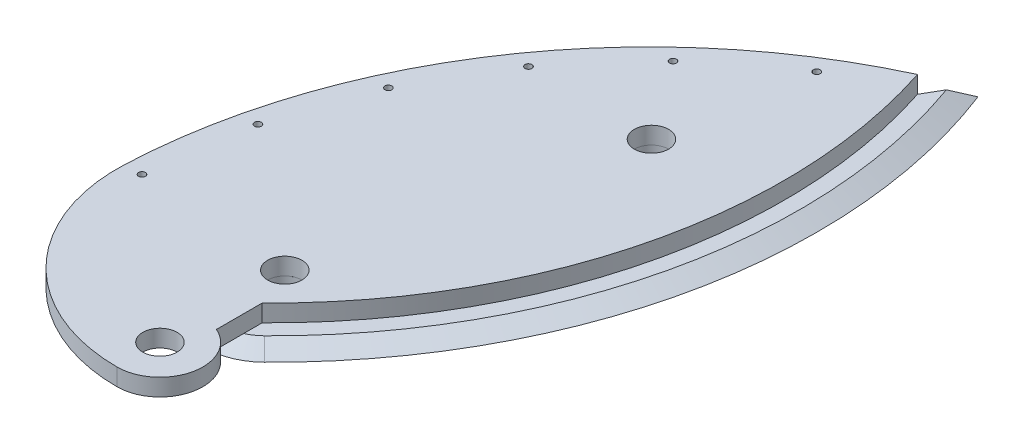
from build123d import *

# Parameters (mm, degrees)
IZIM1_R                     = 5
IZIM1_R_2                   = 12.5
Y_KSEKLIK_EKSTR_ZYON1_DEPTH = 5
IZIM2_R                     = 5
BLADE_DEPTH                 = 3
PAH1_SIZE                   = 3
PAH1_SIZE_2                 = 5.196152423
IZIM3_R                     = 1
KANCA_DELIKLERI_DEPTH       = 199.49265783


with BuildPart() as part:
    # Çizim1 → Yükseklik-Ekstrüzyon1 (new body)
    # profile 1 of 2: a face of its own
    with BuildSketch(Plane(origin=(0, 0, 0), x_dir=(1, 0, 0), z_dir=(0, 1, 0))):
        with BuildLine():
            Line((5, 11.456439237), (5, 24.791036465))
            ThreePointArc((5, 24.791036465), (45.770978253, 95.93703242), (42.789260889, 177.882958308))
            ThreePointArc((42.789260889, 177.882958308), (-22.95720379, 121.802666414), (-49.951060338, 39.711689653))
            ThreePointArc((-49.951060338, 39.711689653), (-36.128828397, 2.935455179), (0, -12.5))
            ThreePointArc((0, -12.5), (-12.236328912, 2.553870546), (5, 11.456439237))
        make_face()
        with Locations(Location((0, 36.360727505, 0), (0, 0, 270))):
            Circle(IZIM1_R, mode=Mode.SUBTRACT)
        with Locations(Location((20.378166684, 122.796020062, 0), (0, 0, 270))):
            Circle(IZIM1_R, mode=Mode.SUBTRACT)
    # profile 2 of 2: a face of its own
    with BuildSketch(Plane(origin=(0, 0, 0), x_dir=(1, 0, 0), z_dir=(0, 1, 0))):
        Circle(IZIM1_R_2)
        with Locations(Location((0, 0, 0), (0, 0, 270))):
            Circle(IZIM1_R, mode=Mode.SUBTRACT)
    extrude(amount=Y_KSEKLIK_EKSTR_ZYON1_DEPTH)

    # Çizim3 → kanca delikleri (cut, through all)
    with BuildSketch(Plane(origin=(0, 5, 0), x_dir=(1, 0, 0), z_dir=(0, 1, 0))):
        with Locations(Location((27.43084459, 163.878722536, 0), (0, 0, 270))):
            Circle(IZIM3_R)
        with Locations(Location((3.807935712, 145.643577542, 0), (0, 0, 270))):
            Circle(IZIM3_R)
        with Locations(Location((-15.882620678, 123.219386901, 0), (0, 0, 270))):
            Circle(IZIM3_R)
        with Locations(Location((-30.910932055, 97.437373908, 0), (0, 0, 270))):
            Circle(IZIM3_R)
        with Locations(Location((-40.719926699, 69.253230123, 0), (0, 0, 270))):
            Circle(IZIM3_R)
        with Locations(Location((-44.94600331, 39.711689653, 0), (0, 0, 270))):
            Circle(IZIM3_R)
    extrude(amount=-KANCA_DELIKLERI_DEPTH, mode=Mode.SUBTRACT)


with BuildPart() as body_2:
    # Çizim2 → blade (new body)
    # profile 1 of 4: a face of its own
    with BuildSketch(Plane.XZ):
        with BuildLine():
            ThreePointArc((-17.5, -30.634192166), (-3.274683301, -47.825074903), (16.274451346, -37.067871781))
            ThreePointArc((16.274451346, -37.067871781), (10.808797948, -30.77189045), (5, -24.791036465))
            Line((5, -24.791036465), (5, -13.863682335))
            ThreePointArc((5, -13.863682335), (-10.458250332, -16.602976965), (-17.5, -30.634192166))
        make_face()
        with Locations(Location((0, -36.360727505, 0), (0, 0, 270))):
            Circle(IZIM2_R, mode=Mode.SUBTRACT)
    # profile 2 of 4: a face of its own
    with BuildSketch(Plane.XZ):
        with BuildLine():
            Line((-17.5, -73.458895297), (42.789260889, -177.882958308))
            ThreePointArc((42.789260889, -177.882958308), (47.54208487, -104.084174823), (16.274451346, -37.067871781))
            ThreePointArc((16.274451346, -37.067871781), (-3.274683301, -47.825074903), (-17.5, -30.634192166))
            Line((-17.5, -30.634192166), (-17.5, -73.458895297))
        make_face()
        with Locations(Location((20.378166684, -122.796020062, 0), (0, 0, 270))):
            Circle(IZIM2_R, mode=Mode.SUBTRACT)
    # profile 3 of 4: a face of its own
    with BuildSketch(Plane.XZ):
        with BuildLine():
            Line((42.789260889, -177.882958308), (49.239635028, -189.055334043))
            ThreePointArc((49.239635028, -189.055334043), (56.347089994, -98.056501036), (12.251738073, -18.138396305))
            ThreePointArc((12.251738073, -18.138396305), (16.134674095, -23.857593324), (17.5, -30.634192166))
            ThreePointArc((17.5, -30.634192166), (17.190882737, -33.908875467), (16.274451346, -37.067871781))
            ThreePointArc((16.274451346, -37.067871781), (47.54208487, -104.084174823), (42.789260889, -177.882958308))
        make_face()
    # profile 4 of 4: a face of its own
    with BuildSketch(Plane.XZ):
        with BuildLine():
            ThreePointArc((17.5, -30.634192166), (16.134674095, -23.857593324), (12.251738073, -18.138396305))
            ThreePointArc((12.251738073, -18.138396305), (8.886726704, -15.558513459), (5, -13.863682335))
            Line((5, -13.863682335), (5, -24.791036465))
            ThreePointArc((5, -24.791036465), (10.808797948, -30.77189045), (16.274451346, -37.067871781))
            ThreePointArc((16.274451346, -37.067871781), (17.190882737, -33.908875467), (17.5, -30.634192166))
        make_face()
    extrude(amount=BLADE_DEPTH)

    # Pah1
    # the kernel refuses this chamfer: 5.196152423, 3 mm, written as the material it takes off along each edge
    with BuildSketch(Plane(origin=(-17.5, 0, -30.634192166), x_dir=(-0.05789386240267091, -0.9983227437537926, 0), z_dir=(0, 0, -1))) as pah1_piece_1:
        Polygon((PAH1_SIZE * 0.998322743754, -PAH1_SIZE * 0.0578938624027), (-PAH1_SIZE_2 * 0.0578938623994, -PAH1_SIZE_2 * 0.998322743697), (0, 0), align=None)
    extrude(amount=56.267595043, mode=Mode.SUBTRACT)
    with BuildSketch(Plane(origin=(0, 0, -30.634192166), x_dir=(0.7000993184445534, 0, 0.7140454777627765), z_dir=(0.7140454777627765, 0, -0.7000993184445534))) as pah1_piece_2:
        Polygon((17.5, PAH1_SIZE), (17.5 - PAH1_SIZE_2, 0), (17.5, 0), align=None)
    revolve(axis=Axis((0, 0, -30.634192166), (0, -1, 0)), revolution_arc=134.434972877, mode=Mode.SUBTRACT)
    with BuildSketch(Plane(origin=(-99.085438878, 0, -131.693438588), x_dir=(0.8988910106587495, 0, -0.43817228456041324), z_dir=(-0.43817228456041324, 0, -0.8988910106587495))) as pah1_piece_3:
        Polygon((159.03054612, PAH1_SIZE), (159.03054612 - PAH1_SIZE_2, 0), (159.03054612, 0), align=None)
    revolve(axis=Axis((-99.085438878, 0, -131.693438588), (0, -1, 0)), revolution_arc=71.552350858, mode=Mode.SUBTRACT)


solid = Compound([part.part, body_2.part])
